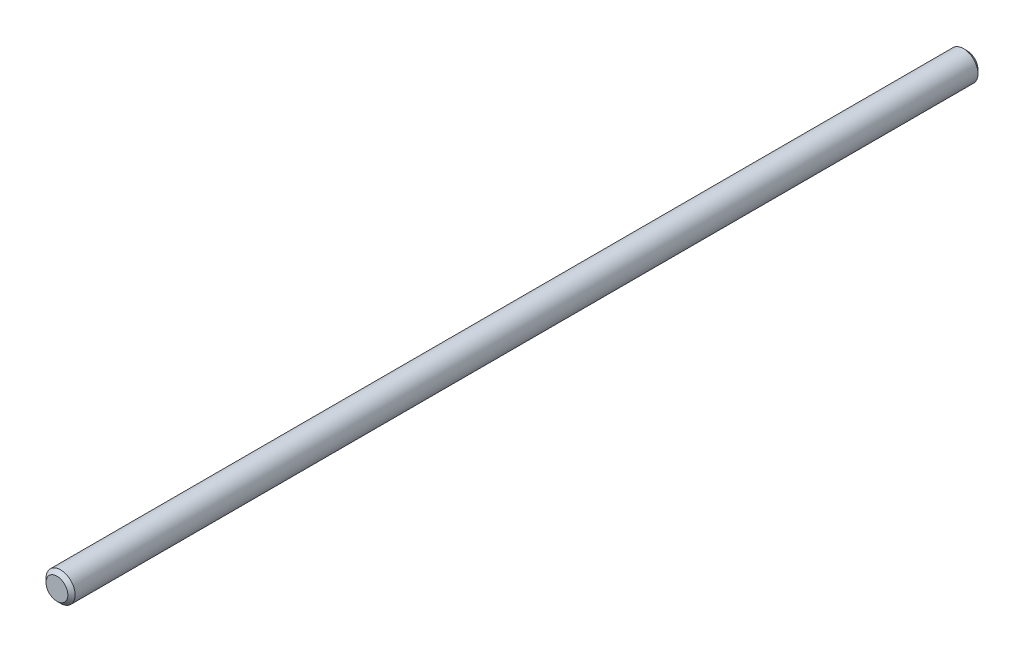
from build123d import *

# Parameters (mm, degrees)
SCHIZZO1_R                   = 4
ESTRUSIONE_ESTRUSIONE1_DEPTH = 250
SMUSSO1_SIZE                 = 1


with BuildPart() as part:
    # Schizzo1 → Estrusione-Estrusione1 (new body)
    with BuildSketch(Plane.XY):
        Circle(SCHIZZO1_R)
    extrude(amount=ESTRUSIONE_ESTRUSIONE1_DEPTH)

    # Smusso1
    smusso1_edges = [part.edges().sort_by_distance(p)[0] for p in [
        (-4, 0, 250),
        (-4, 0, 0),
    ]]
    chamfer(smusso1_edges, length=SMUSSO1_SIZE)


solid = part.part
